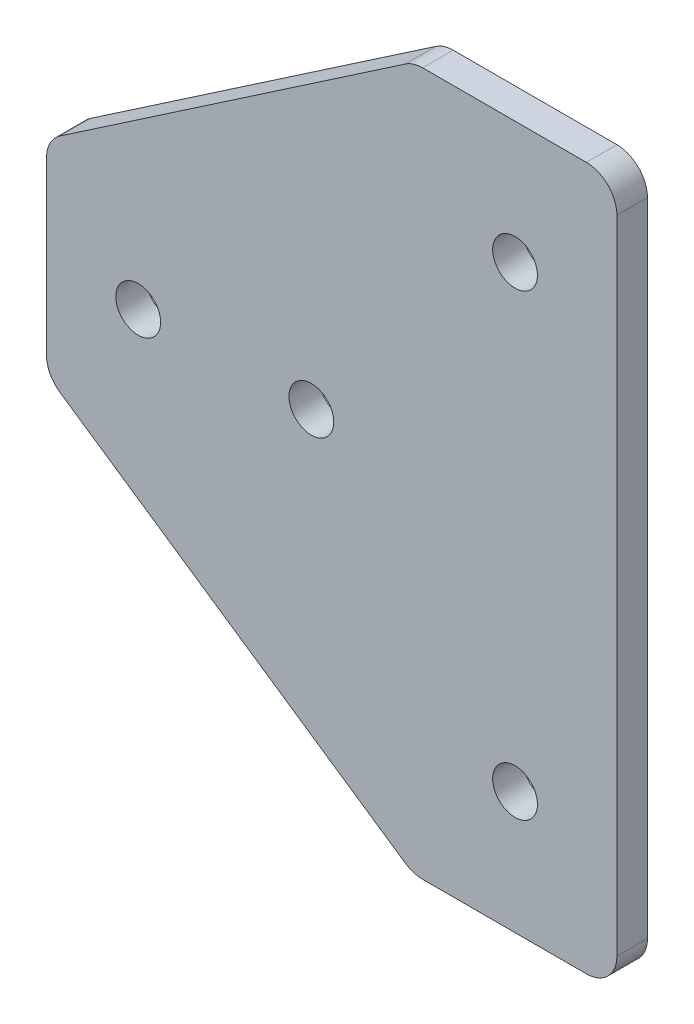
from build123d import *

# Parameters (mm, degrees)
BOSS_EXTRUDE1_DEPTH = 3
SKETCH2_R           = 2.2
CUT_EXTRUDE1_DEPTH  = 66.842615379
FILLET1_R           = 3


with BuildPart() as part:
    # Sketch1 → Boss-Extrude1 (new body)
    with BuildSketch(Plane.XY):
        Polygon((0, -34.5), (0, 34.5), (-20, 34.5), (-56, 10), (-56, -10), (-20, -34.5), align=None)
    extrude(amount=BOSS_EXTRUDE1_DEPTH)

    # Sketch2 → Cut-Extrude1 (cut, through all)
    with BuildSketch(Plane.XY.offset(3)):
        with Locations((-47, 0)):
            Circle(SKETCH2_R)
        with Locations((-30, 0)):
            Circle(SKETCH2_R)
        with Locations((-10, 22.5)):
            Circle(SKETCH2_R)
        with Locations((-10, -22.5)):
            Circle(SKETCH2_R)
    extrude(amount=-CUT_EXTRUDE1_DEPTH, mode=Mode.SUBTRACT)

    # Fillet1
    fillet1_edges = [part.edges().sort_by_distance(p)[0] for p in [
        (0, -34.5, 1.5),
        (-20, -34.5, 1.5),
        (-56, -10, 1.5),
        (-56, 10, 1.5),
        (-20, 34.5, 1.5),
        (0, 34.5, 1.5),
    ]]
    fillet(fillet1_edges, radius=FILLET1_R)


solid = part.part
